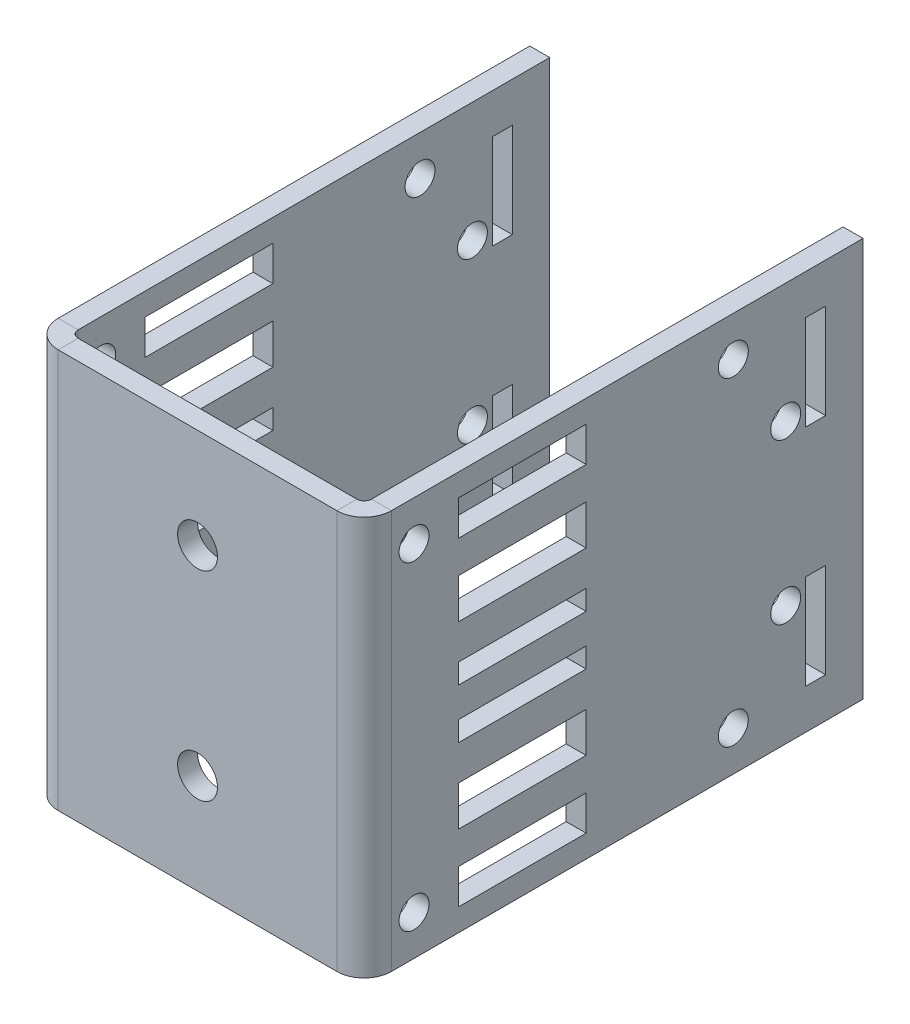
from build123d import *

# Parameters (mm, degrees)
BASE_FLANGE1_DEPTH = 40
SKETCH2_R          = 1.5
SKETCH2_W          = 12.8
SKETCH2_H          = 3.5
SKETCH2_H_2        = 2
SKETCH2_H_3        = 4
SKETCH2_W_2        = 2
SKETCH2_H_4        = 9.5
CUT_EXTRUDE1_DEPTH = 33.4
CUT_EXTRUDE2_REACH = 68.173
SKETCH4_R          = 2


# Sheet-metal steps are written as plain solids
with BuildPart() as part:
    # Sketch1 → Base-Flange1 (new body)
    with BuildSketch(Plane(origin=(0, 0, 0), x_dir=(1, 0, 0), z_dir=(0, 1, 0))):
        with BuildLine():
            Line((14.7, 24), (14.7, -23.2634))
            ThreePointArc((14.7, -23.2634), (14.484254855, -23.784254855), (13.9634, -24))
            Line((13.9634, -24), (-13.9634, -24))
            ThreePointArc((-13.9634, -24), (-14.484254855, -23.784254855), (-14.7, -23.2634))
            Line((-14.7, -23.2634), (-14.7, 24))
            Line((-14.7, 24), (-16.7, 24))
            Line((-16.7, 24), (-16.7, -23.2634))
            ThreePointArc((-16.7, -23.2634), (-15.898468417, -25.198468417), (-13.9634, -26))
            Line((-13.9634, -26), (13.9634, -26))
            ThreePointArc((13.9634, -26), (15.898468417, -25.198468417), (16.7, -23.2634))
            Line((16.7, -23.2634), (16.7, 24))
            Line((16.7, 24), (14.7, 24))
        make_face()
    extrude(amount=BASE_FLANGE1_DEPTH)

    # Sketch2 → Cut-Extrude1 (cut)
    with BuildSketch(Plane.ZY.offset(16.7)):
        with Locations((-16.25, 12)):
            Circle(SKETCH2_R)
        with Locations((-16.25, 28)):
            Circle(SKETCH2_R)
        with Locations((21, 4)):
            Circle(SKETCH2_R)
        with Locations((21, 36)):
            Circle(SKETCH2_R)
        with Locations((-11, 4)):
            Circle(SKETCH2_R)
        with Locations((-11, 36)):
            Circle(SKETCH2_R)
        with Locations((10.15, 36)):
            Rectangle(SKETCH2_W, SKETCH2_H)
        with Locations((10.15, 17.5)):
            Rectangle(SKETCH2_W, SKETCH2_H_2)
        with Locations((10.15, 11)):
            Rectangle(SKETCH2_W, SKETCH2_H_3)
        with Locations((10.15, 29)):
            Rectangle(SKETCH2_W, SKETCH2_H_3)
        with Locations((10.15, 4)):
            Rectangle(SKETCH2_W, SKETCH2_H)
        with Locations((10.15, 22.5)):
            Rectangle(SKETCH2_W, SKETCH2_H_2)
        with Locations((-19.25, 8.75)):
            Rectangle(SKETCH2_W_2, SKETCH2_H_4)
        with Locations((-19.25, 31.25)):
            Rectangle(SKETCH2_W_2, SKETCH2_H_4)
    extrude(amount=-CUT_EXTRUDE1_DEPTH, mode=Mode.SUBTRACT)

    # Sketch4 → Cut-Extrude2 (cut, up to next)
    with BuildSketch(Plane.XY.offset(26), mode=Mode.PRIVATE) as cut_extrude2_sk1:
        with Locations((0, 10)):
            Circle(SKETCH4_R)
    cut_extrude2_tool1 = extrude(cut_extrude2_sk1.sketch, amount=-CUT_EXTRUDE2_REACH, mode=Mode.PRIVATE) & part.part
    # Sketch4 → Cut-Extrude2 (cut, up to next)
    with BuildSketch(Plane.XY.offset(26), mode=Mode.PRIVATE) as cut_extrude2_sk2:
        with Locations((0, 30)):
            Circle(SKETCH4_R)
    cut_extrude2_tool2 = extrude(cut_extrude2_sk2.sketch, amount=-CUT_EXTRUDE2_REACH, mode=Mode.PRIVATE) & part.part
    add(cut_extrude2_tool1.solids().sort_by_distance((0, 10, 26))[0], mode=Mode.SUBTRACT)
    add(cut_extrude2_tool2.solids().sort_by_distance((0, 30, 26))[0], mode=Mode.SUBTRACT)


solid = part.part
